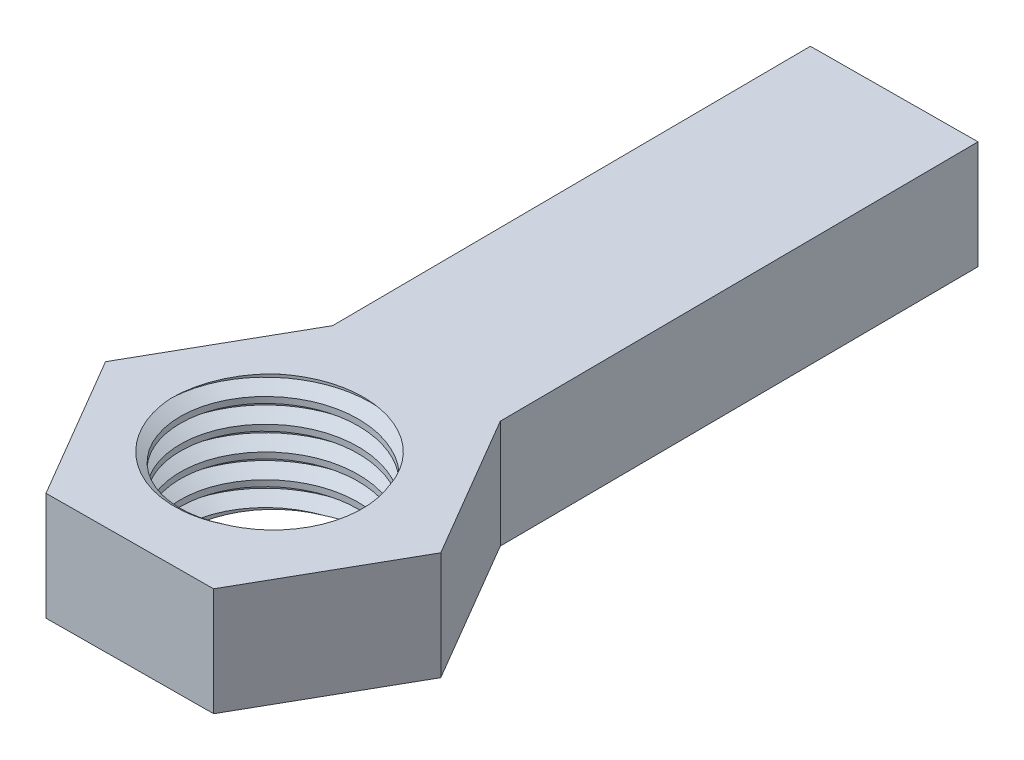
from build123d import *

# Parameters (mm, degrees)
BOSS_EXTRUDE1_DEPTH = 4.5
SKETCH2_R           = 4.25
CUT_EXTRUDE1_DEPTH  = 11.223225637
THREAD1_PITCH       = 1
SKETCH7_R           = 6.424194729
CUT_EXTRUDE2_DEPTH  = 4
SKETCH8_R           = 7.384613595
CUT_EXTRUDE3_DEPTH  = 59.104860868
SKETCH9_W           = 6.92820323
SKETCH9_H           = 4.5
BOSS_EXTRUDE2_DEPTH = 20


with BuildPart() as part:
    # Sketch1 → Boss-Extrude1 (new body)
    with BuildSketch(Plane(origin=(0, 0, 0), x_dir=(1, 0, 0), z_dir=(0, 1, 0))):
        Polygon((3.425444861, 6.022153062), (-3.502615107, 5.9775988), (-6.928059968, -0.044554262), (-3.425444861, -6.022153062), (3.502615107, -5.9775988), (6.928059968, 0.044554262), align=None)
    extrude(amount=BOSS_EXTRUDE1_DEPTH)

    # Sketch2 → Cut-Extrude1 (cut, through all)
    with BuildSketch(Plane(origin=(0, 4.5, 0), x_dir=(1, 0, 0), z_dir=(0, 1, 0))):
        with Locations(Location((0, 0, 0), (0, 0, 270))):
            Circle(SKETCH2_R)
    extrude(amount=-CUT_EXTRUDE1_DEPTH, mode=Mode.SUBTRACT)

    # Thread1: the profile of Thread Profile1 profile screwed along a right-hand helix of 62 turns, 6 arcs to a turn; built about Z, then put on its axis
    thread1_z = Axis((0, 0, 0), (0, 0, 1))
    thread1_corners = [(4.2503, 0, -0.000173205), (4.2503, 0, 0.875173202), (3.708734125, 0, 0.562499999), (3.708734125, 0, 0.312499999)]
    with BuildLine(mode=Mode.PRIVATE) as thread1_profile:
        Line(thread1_corners[0], thread1_corners[1])
        Line(thread1_corners[1], thread1_corners[2])
        Line(thread1_corners[2], thread1_corners[3])
        Line(thread1_corners[3], thread1_corners[0])
    thread1_cap = Face(thread1_profile.wire())
    thread1_turn_angles = [0, 30, 60, 90, 120, 150, 180, 210, 240, 270, 300, 330, 360, 390, 420, 450, 480, 510, 540, 570, 600, 630, 660, 690, 720]
    thread1_turn_weights = [1, 0.8660254037844387, 1, 0.8660254037844387, 1, 0.8660254037844387, 1, 0.8660254037844387, 1, 0.8660254037844387, 1, 0.8660254037844387, 1, 0.8660254037844387, 1, 0.8660254037844387, 1, 0.8660254037844387, 1, 0.8660254037844387, 1, 0.8660254037844387, 1, 0.8660254037844387, 1]
    thread1_turn_rails = [Edge.make_bspline([Vector(p[0], p[1], 0).rotate(thread1_z, thread1_turn_angles[k]) / thread1_turn_weights[k] + Vector(0, 0, p[2] + THREAD1_PITCH * thread1_turn_angles[k] / 360) for k in range(25)], [0, 0, 0, 1, 1, 2, 2, 3, 3, 4, 4, 5, 5, 6, 6, 7, 7, 8, 8, 9, 9, 10, 10, 11, 11, 12, 12, 12], 2, thread1_turn_weights) for p in thread1_corners]
    thread1_turn_sides = [Face.make_surface_from_curves(thread1_turn_rails[p[0]], thread1_turn_rails[p[1]]) for p in [(0, 1), (1, 2), (2, 3), (3, 0)]]
    thread1 = Plane(origin=(0, 5.5, 0), x_dir=(-1, 0, 0), z_dir=(0, -1, 0)) * Solid(Shell([*[p.moved(Location((0, 0, 2 * THREAD1_PITCH * i))) for i in range(31) for p in thread1_turn_sides], thread1_cap, thread1_cap.rotate(thread1_z, 22320).moved(Location((0, 0, THREAD1_PITCH * 22320 / 360)))]))
    add(thread1)

    # Sketch7 → Cut-Extrude2 (cut)
    with BuildSketch(Plane(origin=(0, 4.5, 0), x_dir=(1, 0, 0), z_dir=(0, 1, 0))):
        Circle(SKETCH7_R)
    extrude(amount=CUT_EXTRUDE2_DEPTH, mode=Mode.SUBTRACT)

    # Sketch8 → Cut-Extrude3 (cut, through all)
    with BuildSketch(Plane.XZ):
        Circle(SKETCH8_R)
    extrude(amount=CUT_EXTRUDE3_DEPTH, mode=Mode.SUBTRACT)

    # Sketch9 → Boss-Extrude2 (add)
    with BuildSketch(Plane(origin=(-0.038585123, 0, -5.999875931), x_dir=(-0.9999793218458328, 0, 0.006430853811759884), z_dir=(-0.006430853811759884, 0, -0.9999793218458328))):
        with Locations((0, 2.25)):
            Rectangle(SKETCH9_W, SKETCH9_H)
    extrude(amount=BOSS_EXTRUDE2_DEPTH)


solid = part.part
